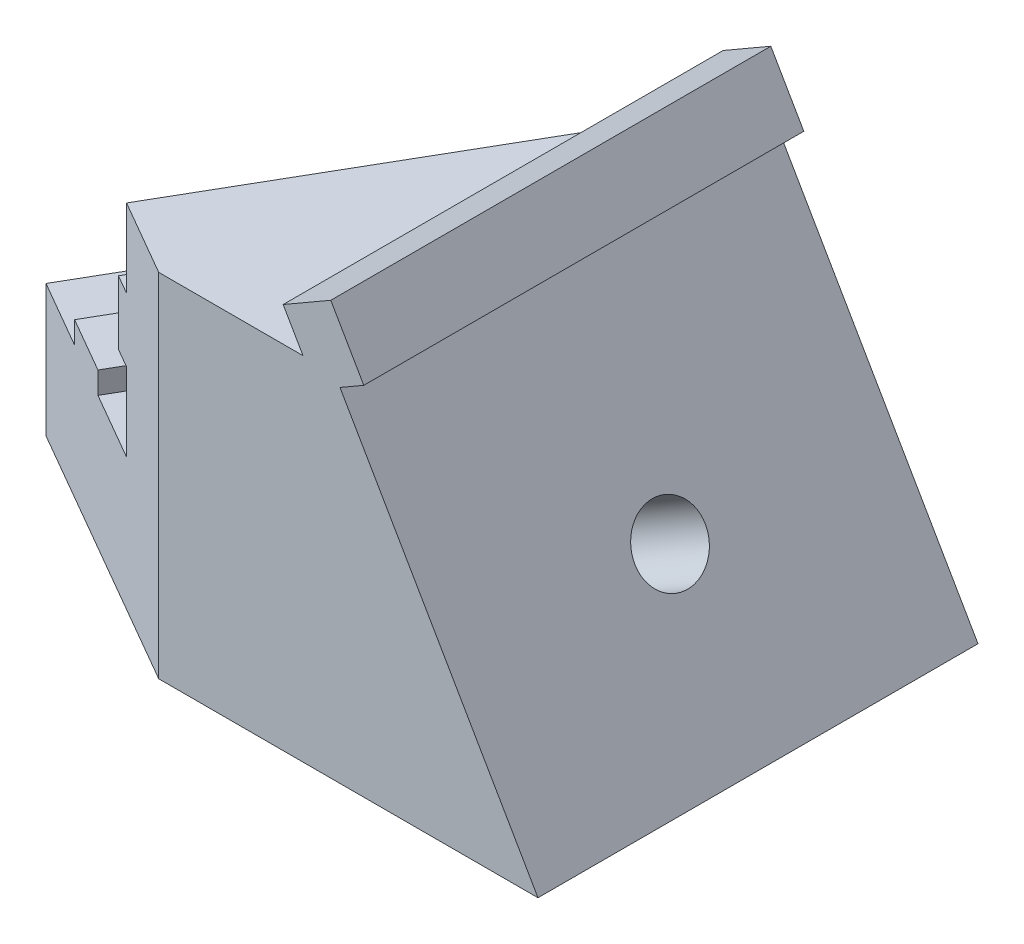
from build123d import *

# Parameters (mm, degrees)
BOSS_EXTRU_1_DEPTH             = 20
ESQUISSE2_R                    = 1.6
HOLEFORLAUNCHERFIXING_DEPTH    = 26.298221281
ESQUISSE4_W                    = 22.287049145
ESQUISSE4_H                    = 34.815979295
ENL_V_MAT_EXTRU_3_DEPTH        = 6
MAKERBEANFIXING_DEPTH          = 21
ESQUISSE6_W                    = 20
ESQUISSE6_H                    = 3
ANTIROTATIONSYSTEM_DEPTH       = 1.25
ESQUISSE7_R                    = 1.6
TOPMAKERBEANFIXINGHOLE_DEPTH   = 29.924856532
ENL_V_MAT_EXTRU_4_DEPTH        = 33.419265786
ESQUISSE3_R                    = 4.25
BIGHOLEFORLAUNCHERFIXING_DEPTH = 32.955759287


with BuildPart() as part:
    # Esquisse1 → Boss.-Extru.1 (new body)
    with BuildSketch(Plane.XY):
        Polygon((8, 16), (17.237604307, 0), (0, 0), (0, 16), align=None)
    extrude(amount=BOSS_EXTRU_1_DEPTH)

    # Esquisse2 → HoleForLauncherFixing (cut, through all)
    with BuildSketch(Plane(origin=(12.92820323, 7.464101615, 0), x_dir=(0, 0, -1), z_dir=(0.8660254037844397, 0.49999999999999806, 0))):
        with Locations((-10, -0.618802154)):
            Circle(ESQUISSE2_R)
    extrude(amount=-HOLEFORLAUNCHERFIXING_DEPTH, mode=Mode.SUBTRACT)

    # Esquisse4 → Enlèv. mat.-Extru.3 (cut)
    with BuildSketch(Plane(origin=(0, 0, 0), x_dir=(0, -1, 0), z_dir=(-0.8660254037844398, 0, -0.499999999999998))):
        with Locations((-6.644134867, 0.407683814)):
            Rectangle(ESQUISSE4_W, ESQUISSE4_H)
    extrude(amount=-ENL_V_MAT_EXTRU_3_DEPTH, mode=Mode.SUBTRACT)

    # Esquisse5 → MakerBeanFixing (add)
    with BuildSketch(Plane(origin=(-3.464101615, 0, 18), x_dir=(-0.8660254037844398, 0, -0.49999999999999806), z_dir=(0.499999999999998, 0, -0.8660254037844397))):
        Polygon((-4, 0), (10, 0), (10, 6), (6.45, 6), (6.45, 7), (3.55, 7), (3.55, 6), (0, 6), (0, 9.55), (1, 9.55), (1, 12.45), (0, 12.45), (0, 16), (-4, 16), align=None)
    extrude(amount=MAKERBEANFIXING_DEPTH)

    # Esquisse6 → AntiRotationSystem (add, symmetric)
    with BuildSketch(Plane(origin=(12.92820323, 7.464101615, 0), x_dir=(0, 0, -1), z_dir=(0.8660254037844398, 0.4999999999999981, 0))):
        with Locations((-10, 10.881197846)):
            Rectangle(ESQUISSE6_W, ESQUISSE6_H)
    extrude(amount=ANTIROTATIONSYSTEM_DEPTH, both=True)

    # Esquisse7 → TopMakerBeanFixingHole (cut, through all)
    with BuildSketch(Plane(origin=(0, 7, 0), x_dir=(1, 0, 0), z_dir=(0, 1, 0))):
        with Locations((0.205771366, -1.643593539)):
            Circle(ESQUISSE7_R)
    extrude(amount=-TOPMAKERBEANFIXINGHOLE_DEPTH, mode=Mode.SUBTRACT)

    # Esquisse8 → Enlèv. mat.-Extru.4 (cut, through all)
    with BuildSketch(Plane(origin=(0, 0, 0), x_dir=(-1, 0, 0), z_dir=(0, 0, -1))):
        Polygon((-8.237604307, 15.588457268), (-17.237604307, 0), (-20.918212273, 2.125), (-10.418212273, 20.311533479), (-7.820136062, 18.811533479), (-9.320136062, 16.213457268), align=None)
    extrude(amount=-ENL_V_MAT_EXTRU_4_DEPTH, mode=Mode.SUBTRACT)

    # Esquisse3 → BigHoleForLauncherFixing (cut, through all)
    with BuildSketch(Plane(origin=(8.598076211, 4.964101615, 0), x_dir=(0, 0, -1), z_dir=(0.8660254037844397, 0.49999999999999806, 0))):
        with Locations((-10, -0.618802154)):
            Circle(ESQUISSE3_R)
    extrude(amount=-BIGHOLEFORLAUNCHERFIXING_DEPTH, mode=Mode.SUBTRACT)


solid = part.part
